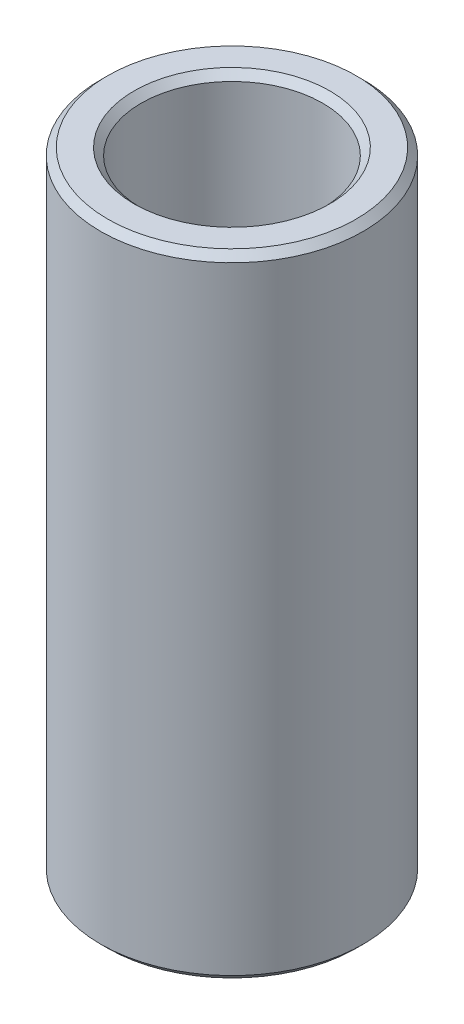
from build123d import *

# Parameters (mm, degrees)
SKETCH1_R           = 55
BOSS_EXTRUDE1_DEPTH = 264.428492496
SKETCH2_R           = 38.025043053
CUT_EXTRUDE1_DEPTH  = 276.630962781
CHAMFER1_SIZE       = 2.973114012


with BuildPart() as part:
    # Sketch1 → Boss-Extrude1 (new body)
    with BuildSketch(Plane(origin=(0, 0, 0), x_dir=(1, 0, 0), z_dir=(0, 1, 0))):
        Circle(SKETCH1_R)
    extrude(amount=BOSS_EXTRUDE1_DEPTH)

    # Sketch2 → Cut-Extrude1 (cut, through all)
    with BuildSketch(Plane(origin=(0, 0, 0), x_dir=(1, 0, 0), z_dir=(0, 1, 0))):
        Circle(SKETCH2_R)
    extrude(amount=CUT_EXTRUDE1_DEPTH, mode=Mode.SUBTRACT)

    # Chamfer1
    chamfer1_edges = [part.edges().sort_by_distance(p)[0] for p in [
        (-38.025043053, 264.428492496, 0),
        (-38.025043053, 0, 0),
        (-55, 0, 0),
        (-55, 264.428492496, 0),
    ]]
    chamfer(chamfer1_edges, length=CHAMFER1_SIZE)


solid = part.part
